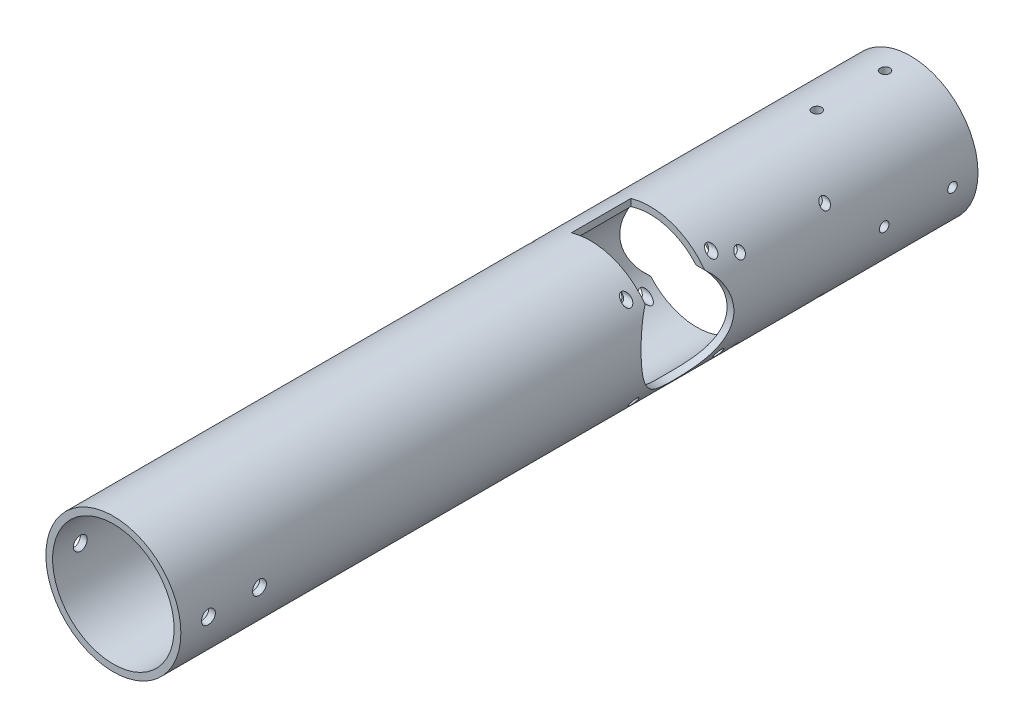
from build123d import *

# Parameters (mm, degrees)
BOSS_EXTRUDE1_DEPTH           = 125
BOSS_EXTRUDE1_DEPTH_BACK      = 250
SKETCH1_R                     = 31.75
SKETCH1_R_2                   = 28.575
SKETCH2_R                     = 21.75
CUT_EXTRUDE1_DEPTH            = 255.000246063
SKETCH3_R                     = 21.75
CUT_EXTRUDE2_DEPTH            = 255.000246186
CUT_EXTRUDE4_START            = 9
SKETCH5_W                     = 28
SKETCH5_H                     = 22
CUT_EXTRUDE4_DEPTH            = 264.000246186
CUT_EXTRUDE5_START            = -9
SKETCH6_W                     = 28
SKETCH6_H                     = 22
CUT_EXTRUDE5_DEPTH            = 264.000246186
CUT_EXTRUDE8_DEPTH            = 255.000246186
CUT_EXTRUDE8_DEPTH_BACK       = 255.000246186
SKETCH11_R                    = 2
CUT_EXTRUDE10_DEPTH           = 255.000246186
CUT_EXTRUDE10_DEPTH_BACK      = 255.000246186
SKETCH12_R                    = 3.25
SKETCH13_R                    = 2.25
CUT_EXTRUDE11_DEPTH           = 255.000246186
CUT_EXTRUDE12_DEPTH           = 255.000246189
CUT_EXTRUDE12_DEPTH_BACK      = 255.000246189
SKETCH15_R                    = 2
SKETCH19_W                    = 2.25
SKETCH19_H                    = 31.75
M4_CLEARANCE_HOLE1_AT_2_COUNT = 2
M4_CLEARANCE_HOLE1_AT_2_PITCH = 40
M4_CLEARANCE_HOLE1_AT_3_COUNT = 2
M4_CLEARANCE_HOLE1_AT_3_PITCH = 40
M4_CLEARANCE_HOLE1_AT_4_COUNT = 2
M4_CLEARANCE_HOLE1_AT_4_PITCH = 56.568542495
M4_CLEARANCE_HOLE1_AT_5_COUNT = 2
M4_CLEARANCE_HOLE1_AT_5_PITCH = 90.126807577
M4_CLEARANCE_HOLE1_AT_6_COUNT = 2
M4_CLEARANCE_HOLE1_AT_6_PITCH = 50.197623888
M4_CLEARANCE_HOLE1_AT_7_COUNT = 2
M4_CLEARANCE_HOLE1_AT_7_PITCH = 100.213978286
M4_CLEARANCE_HOLE1_AT_8_COUNT = 2
M4_CLEARANCE_HOLE1_AT_8_PITCH = 66.631835064
MIRROR1_COPY_1_SKETCH_W       = 2.25
MIRROR1_COPY_1_SKETCH_H       = 31.75
MIRROR1_COPY_2_SKETCH_W       = 2.25
MIRROR1_COPY_2_SKETCH_H       = 31.75
MIRROR1_COPY_3_SKETCH_W       = 2.25
MIRROR1_COPY_3_SKETCH_H       = 31.75
MIRROR1_COPY_4_SKETCH_W       = 2.25
MIRROR1_COPY_4_SKETCH_H       = 31.75
MIRROR1_COPY_5_SKETCH_W       = 2.25
MIRROR1_COPY_5_SKETCH_H       = 31.75
MIRROR1_COPY_6_SKETCH_W       = 2.25
MIRROR1_COPY_6_SKETCH_H       = 31.75
MIRROR1_COPY_7_SKETCH_W       = 2.25
MIRROR1_COPY_7_SKETCH_H       = 31.75
SKETCH21_R                    = 30
CUT_EXTRUDE14_DEPTH           = 7
CIRPATTERN1_COUNT             = 2
CIRPATTERN1_ANGLE             = 90


with BuildPart() as part:
    # Sketch1 → Boss-Extrude1 (new, two sides: drawn at the far end of the back side and taken through both)
    with BuildSketch(Plane.XY.offset(-BOSS_EXTRUDE1_DEPTH_BACK)):
        Circle(SKETCH1_R)
        Circle(SKETCH1_R_2, mode=Mode.SUBTRACT)
    extrude(amount=BOSS_EXTRUDE1_DEPTH + BOSS_EXTRUDE1_DEPTH_BACK)

    # Sketch2 → Cut-Extrude1 (cut, through all)
    with BuildSketch(Plane(origin=(0, 0, 0), x_dir=(0, 0, -1), z_dir=(1, 0, 0))):
        with Locations((163.488, -2)):
            Circle(SKETCH2_R)
    extrude(amount=-CUT_EXTRUDE1_DEPTH, mode=Mode.SUBTRACT)

    # Sketch3 → Cut-Extrude2 (cut, through all)
    with BuildSketch(Plane(origin=(0, 0, 0), x_dir=(0, 0, -1), z_dir=(1, 0, 0))):
        with Locations((113.45, 2)):
            Circle(SKETCH3_R)
    extrude(amount=CUT_EXTRUDE2_DEPTH, mode=Mode.SUBTRACT)

    # Sketch5 → Cut-Extrude4 (cut, through all)
    with BuildSketch(Plane(origin=(0, 0, 0), x_dir=(0, 0, -1), z_dir=(1, 0, 0)).offset(CUT_EXTRUDE4_START)):
        with Locations((163.488, -23.75)):
            Rectangle(SKETCH5_W, SKETCH5_H)
    extrude(amount=-CUT_EXTRUDE4_DEPTH, mode=Mode.SUBTRACT)

    # Sketch6 → Cut-Extrude5 (cut, through all)
    with BuildSketch(Plane(origin=(0, 0, 0), x_dir=(0, 0, -1), z_dir=(1, 0, 0)).offset(CUT_EXTRUDE5_START)):
        with Locations((113.45, 23.75)):
            Rectangle(SKETCH6_W, SKETCH6_H)
    extrude(amount=CUT_EXTRUDE5_DEPTH, mode=Mode.SUBTRACT)

    # Sketch11 → Cut-Extrude8 (cut, two sides: drawn at the far end of the back side and taken through both)
    with BuildSketch(Plane(origin=(0, 0, 0), x_dir=(0, 0, -1), z_dir=(1, 0, 0)).offset(-CUT_EXTRUDE8_DEPTH_BACK)):
        with Locations((183.488, 18)):
            Circle(SKETCH11_R)
        with Locations((143.488, 18)):
            Circle(SKETCH11_R)
        with Locations((143.488, -22)):
            Circle(SKETCH11_R)
        with Locations((183.488, -22)):
            Circle(SKETCH11_R)
    extrude(amount=CUT_EXTRUDE8_DEPTH + CUT_EXTRUDE8_DEPTH_BACK, mode=Mode.SUBTRACT)

    # Sketch12 → Cut-Extrude10 (cut, two sides: drawn at the far end of the back side and taken through both)
    with BuildSketch(Plane(origin=(0, 0, 0), x_dir=(0, 0, -1), z_dir=(1, 0, 0)).offset(-CUT_EXTRUDE10_DEPTH_BACK)):
        with Locations((-112, 0)):
            Circle(SKETCH12_R)
        with Locations((-88, 0)):
            Circle(SKETCH12_R)
    extrude(amount=CUT_EXTRUDE10_DEPTH + CUT_EXTRUDE10_DEPTH_BACK, mode=Mode.SUBTRACT)

    # Sketch13 → Cut-Extrude11 (cut, symmetric)
    with BuildSketch(Plane(origin=(0, 0, 0), x_dir=(1, 0, 0), z_dir=(0, 1, 0))):
        with Locations((0, 238)):
            Circle(SKETCH13_R)
        with Locations((0, 205.9)):
            Circle(SKETCH13_R)
    cut_extrude11 = extrude(amount=CUT_EXTRUDE11_DEPTH, both=True, mode=Mode.SUBTRACT)

    # Sketch15 → Cut-Extrude12 (cut, two sides: drawn at the far end of the back side and taken through both)
    with BuildSketch(Plane(origin=(0, 0, 0), x_dir=(0, 0, -1), z_dir=(1, 0, 0)).offset(-CUT_EXTRUDE12_DEPTH_BACK)):
        with Locations((93.45, 22)):
            Circle(SKETCH15_R)
        with Locations((133.45, 22)):
            Circle(SKETCH15_R)
        with Locations((133.45, -18)):
            Circle(SKETCH15_R)
        with Locations((93.45, -18)):
            Circle(SKETCH15_R)
    extrude(amount=CUT_EXTRUDE12_DEPTH + CUT_EXTRUDE12_DEPTH_BACK, mode=Mode.SUBTRACT)

    # Sketch19 → M4 Clearance Hole1 (revolve, cut)
    with BuildSketch(Plane(origin=(0, 22, -93.45), x_dir=(0, 0, 1), z_dir=(0, 1, 0))):
        with Locations((1.125, 15.875)):
            Rectangle(SKETCH19_W, SKETCH19_H)
    m4_clearance_hole1 = revolve(axis=Axis((-6.35, 22, -93.45), (1, 0, 0)), mode=Mode.SUBTRACT)

    # M4 Clearance Hole1 at 2: M4 Clearance Hole1 ×2
    with Locations(*[(0, 0, -i * M4_CLEARANCE_HOLE1_AT_2_PITCH) for i in range(1, M4_CLEARANCE_HOLE1_AT_2_COUNT)]):
        add(m4_clearance_hole1, mode=Mode.SUBTRACT)

    # M4 Clearance Hole1 at 3: M4 Clearance Hole1 ×2
    with Locations(*[(0, -i * M4_CLEARANCE_HOLE1_AT_3_PITCH, 0) for i in range(1, M4_CLEARANCE_HOLE1_AT_3_COUNT)]):
        add(m4_clearance_hole1, mode=Mode.SUBTRACT)

    # M4 Clearance Hole1 at 4: M4 Clearance Hole1 ×2
    with Locations(*[Vector(0, -0.7071067811865475, -0.7071067811865477) * (i * M4_CLEARANCE_HOLE1_AT_4_PITCH) for i in range(1, M4_CLEARANCE_HOLE1_AT_4_COUNT)]):
        add(m4_clearance_hole1, mode=Mode.SUBTRACT)

    # M4 Clearance Hole1 at 5: M4 Clearance Hole1 ×2
    with Locations(*[Vector(0, -0.04438191152602299, -0.9990146374950151) * (i * M4_CLEARANCE_HOLE1_AT_5_PITCH) for i in range(1, M4_CLEARANCE_HOLE1_AT_5_COUNT)]):
        add(m4_clearance_hole1, mode=Mode.SUBTRACT)

    # M4 Clearance Hole1 at 6: M4 Clearance Hole1 ×2
    with Locations(*[Vector(0, -0.07968504662542596, -0.9968200907607669) * (i * M4_CLEARANCE_HOLE1_AT_6_PITCH) for i in range(1, M4_CLEARANCE_HOLE1_AT_6_COUNT)]):
        add(m4_clearance_hole1, mode=Mode.SUBTRACT)

    # M4 Clearance Hole1 at 7: M4 Clearance Hole1 ×2
    with Locations(*[Vector(0, -0.43906050585303286, -0.8984574960453493) * (i * M4_CLEARANCE_HOLE1_AT_7_PITCH) for i in range(1, M4_CLEARANCE_HOLE1_AT_7_COUNT)]):
        add(m4_clearance_hole1, mode=Mode.SUBTRACT)

    # M4 Clearance Hole1 at 8: M4 Clearance Hole1 ×2
    with Locations(*[Vector(0, -0.6603450131265123, -0.7509623583369186) * (i * M4_CLEARANCE_HOLE1_AT_8_PITCH) for i in range(1, M4_CLEARANCE_HOLE1_AT_8_COUNT)]):
        add(m4_clearance_hole1, mode=Mode.SUBTRACT)

    # Mirror1: M4 Clearance Hole1 across plane
    add(m4_clearance_hole1.mirror(Plane(origin=(0, 0, 0), x_dir=(0, 0, 1), z_dir=(1, 0, 0))), mode=Mode.SUBTRACT)

    # Mirror1 copy 1 sketch → Mirror1 copy 1 (revolve, cut)
    with BuildSketch(Plane(origin=(0, 22, -133.45), x_dir=(0, 0, 1), z_dir=(0, 1, 0))):
        with Locations((1.125, -15.875)):
            Rectangle(MIRROR1_COPY_1_SKETCH_W, MIRROR1_COPY_1_SKETCH_H)
    revolve(axis=Axis((6.35, 22, -133.45), (1, 0, 0)), mode=Mode.SUBTRACT)

    # Mirror1 copy 2 sketch → Mirror1 copy 2 (revolve, cut)
    with BuildSketch(Plane(origin=(0, -18, -93.45), x_dir=(0, 0, 1), z_dir=(0, 1, 0))):
        with Locations((1.125, -15.875)):
            Rectangle(MIRROR1_COPY_2_SKETCH_W, MIRROR1_COPY_2_SKETCH_H)
    revolve(axis=Axis((6.35, -18, -93.45), (1, 0, 0)), mode=Mode.SUBTRACT)

    # Mirror1 copy 3 sketch → Mirror1 copy 3 (revolve, cut)
    with BuildSketch(Plane(origin=(0, -18, -133.45), x_dir=(0, 0, 1), z_dir=(0, 1, 0))):
        with Locations((1.125, -15.875)):
            Rectangle(MIRROR1_COPY_3_SKETCH_W, MIRROR1_COPY_3_SKETCH_H)
    revolve(axis=Axis((6.35, -18, -133.45), (1, 0, 0)), mode=Mode.SUBTRACT)

    # Mirror1 copy 4 sketch → Mirror1 copy 4 (revolve, cut)
    with BuildSketch(Plane(origin=(0, 18, -183.488), x_dir=(0, 0, 1), z_dir=(0, 1, 0))):
        with Locations((1.125, -15.875)):
            Rectangle(MIRROR1_COPY_4_SKETCH_W, MIRROR1_COPY_4_SKETCH_H)
    revolve(axis=Axis((6.35, 18, -183.488), (1, 0, 0)), mode=Mode.SUBTRACT)

    # Mirror1 copy 5 sketch → Mirror1 copy 5 (revolve, cut)
    with BuildSketch(Plane(origin=(0, 18, -143.488), x_dir=(0, 0, 1), z_dir=(0, 1, 0))):
        with Locations((1.125, -15.875)):
            Rectangle(MIRROR1_COPY_5_SKETCH_W, MIRROR1_COPY_5_SKETCH_H)
    revolve(axis=Axis((6.35, 18, -143.488), (1, 0, 0)), mode=Mode.SUBTRACT)

    # Mirror1 copy 6 sketch → Mirror1 copy 6 (revolve, cut)
    with BuildSketch(Plane(origin=(0, -22, -183.488), x_dir=(0, 0, 1), z_dir=(0, 1, 0))):
        with Locations((1.125, -15.875)):
            Rectangle(MIRROR1_COPY_6_SKETCH_W, MIRROR1_COPY_6_SKETCH_H)
    revolve(axis=Axis((6.35, -22, -183.488), (1, 0, 0)), mode=Mode.SUBTRACT)

    # Mirror1 copy 7 sketch → Mirror1 copy 7 (revolve, cut)
    with BuildSketch(Plane(origin=(0, -22, -143.488), x_dir=(0, 0, 1), z_dir=(0, 1, 0))):
        with Locations((1.125, -15.875)):
            Rectangle(MIRROR1_COPY_7_SKETCH_W, MIRROR1_COPY_7_SKETCH_H)
    revolve(axis=Axis((6.35, -22, -143.488), (1, 0, 0)), mode=Mode.SUBTRACT)

    # Sketch21 → Cut-Extrude14 (cut)
    with BuildSketch(Plane(origin=(0, 0, -250), x_dir=(-1, 0, 0), z_dir=(0, 0, -1))):
        Circle(SKETCH21_R)
    extrude(amount=-CUT_EXTRUDE14_DEPTH, mode=Mode.SUBTRACT)

    # CirPattern1: Cut-Extrude11 ×2 about axis
    cirpattern1_axis = Axis((0, 0, -250), (0, 0, 1))
    for i in range(1, CIRPATTERN1_COUNT):
        add(cut_extrude11.rotate(cirpattern1_axis, i * CIRPATTERN1_ANGLE / (CIRPATTERN1_COUNT - 1)), mode=Mode.SUBTRACT)


solid = part.part
